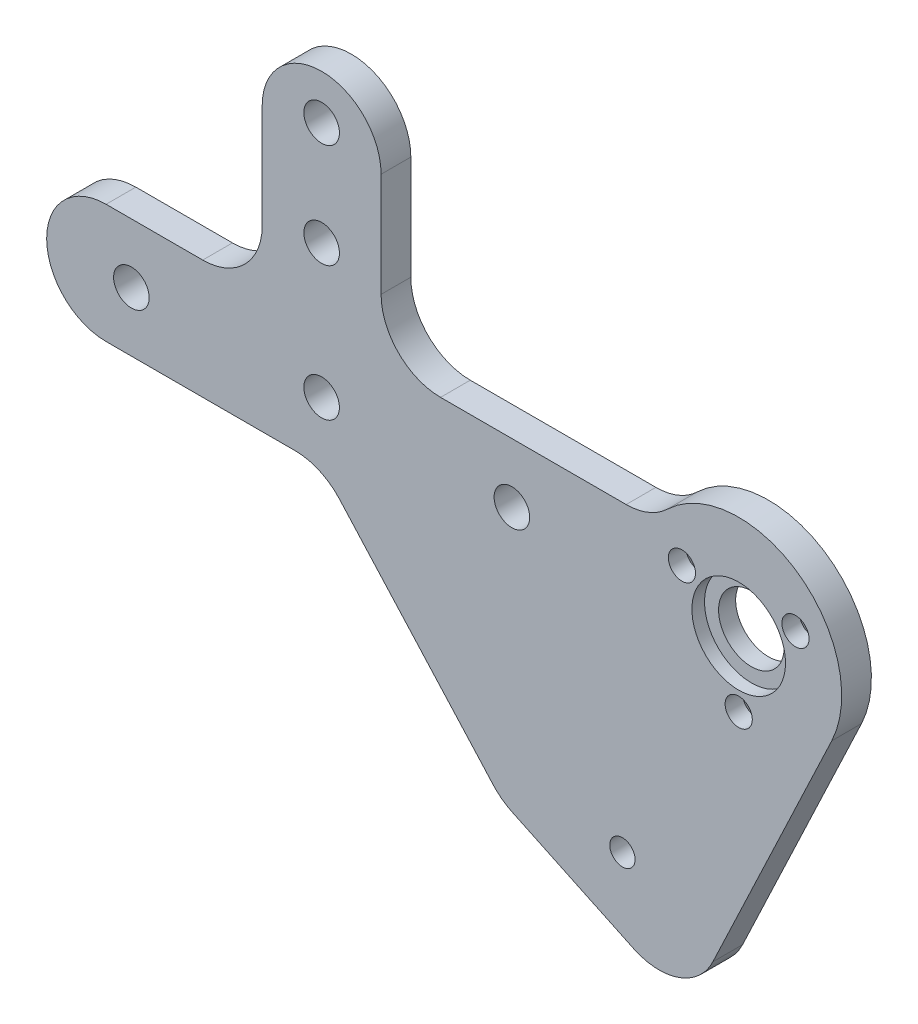
from build123d import *

# Parameters (mm, degrees)
SKETCH1_R                                        = 3.5
BODY_DEPTH                                       = 3.175
F_6_GIMBAL_CLEARANCE_HOLE_D                      = 3.7973
F_6_GIMBAL_CLEARANCE_HOLE_DEPTH                  = 12
F_6_GIMBAL_CLEARANCE_HOLE_TIP                    = 1.140824014
CSK_FOR_M2_5_FLAT_HEAD_MACHINE_SCREW_D           = 2.9
CSK_FOR_M2_5_FLAT_HEAD_MACHINE_SCREW_CSINK_D     = 5.5
CSK_FOR_M2_5_FLAT_HEAD_MACHINE_SCREW_CSINK_ANGLE = 90
F_6_CIRCULAR_CLEARANCE_HOLES_D                   = 3.7973
F_6_CIRCULAR_CLEARANCE_HOLES_DEPTH               = 12
F_6_CIRCULAR_CLEARANCE_HOLES_TIP                 = 1.140824014
MOTOR_START                                      = 1.82626
SKETCH1_3_R                                      = 5
MOTOR_COLLAR_RELIEF_DEPTH                        = 135.039371942
F_6_32_TAPPED_HOLE_D                             = 2.7051
F_6_32_TAPPED_HOLE_DEPTH                         = 180.4416
F_6_32_TAPPED_HOLE_TIP                           = 0.81269403
FILLET1_R                                        = 6.35


with BuildPart() as part:
    # Sketch1 → Body (new body)
    with BuildSketch(Plane.XY):
        with BuildLine():
            Line((-29.36875, 100.140279829), (-29.36875, 87.440279829))
            Line((-29.36875, 87.440279829), (0, 87.440279829))
            Line((0, 87.440279829), (19.184718186, 66.158495963))
            Line((19.184718186, 66.158495963), (39.064677756, 56.735799561))
            Line((39.064677756, 56.735799561), (54.483635505, 89.266642494))
            ThreePointArc((54.483635505, 89.266642494), (49.996218262, 103.531501135), (35.431784746, 100.140279829))
            Line((35.431784746, 100.140279829), (6.35, 100.140279829))
            Line((6.35, 100.140279829), (6.35, 117.602779829))
            ThreePointArc((6.35, 117.602779829), (0, 123.952779829), (-6.35, 117.602779829))
            Line((-6.35, 117.602779829), (-6.35, 100.140279829))
            Line((-6.35, 100.140279829), (-29.36875, 100.140279829))
        make_face()
        with Locations((44.54365572, 93.977990695)):
            Circle(SKETCH1_R, mode=Mode.SUBTRACT)
    extrude(amount=BODY_DEPTH)

    # #6 Gimbal Clearance Hole
    with Locations(Plane(origin=(0, 108.077779829, 0), x_dir=(-1, 0, 0), z_dir=(0, 0, -1))):
        with Locations((0, 0), (0, 11.1125)):
            Hole(F_6_GIMBAL_CLEARANCE_HOLE_D / 2, depth=F_6_GIMBAL_CLEARANCE_HOLE_DEPTH)
            with Locations((0, 0, -(F_6_GIMBAL_CLEARANCE_HOLE_DEPTH + F_6_GIMBAL_CLEARANCE_HOLE_TIP / 2))):  # 118° drill point
                Cone(0, F_6_GIMBAL_CLEARANCE_HOLE_D / 2, F_6_GIMBAL_CLEARANCE_HOLE_TIP, mode=Mode.SUBTRACT)

    # CSK for M2.5 Flat Head Machine Screw (through all)
    with Locations(Plane(origin=(50.605833546, 97.477990695, 0), x_dir=(-1, 0, 0), z_dir=(0, 0, -1))):
        with Locations((0, 0), (6.062177826, -10.5), (12.124355653, 0)):
            CounterSinkHole(CSK_FOR_M2_5_FLAT_HEAD_MACHINE_SCREW_D / 2, CSK_FOR_M2_5_FLAT_HEAD_MACHINE_SCREW_CSINK_D / 2, counter_sink_angle=CSK_FOR_M2_5_FLAT_HEAD_MACHINE_SCREW_CSINK_ANGLE)

    # #6 Circular Clearance Holes
    with Locations(Plane(origin=(-20.32, 93.790279829, 0), x_dir=(-1, 0, 0), z_dir=(0, 0, -1))):
        with Locations((0, 0), (-20.32, 0), (-40.64, 0)):
            Hole(F_6_CIRCULAR_CLEARANCE_HOLES_D / 2, depth=F_6_CIRCULAR_CLEARANCE_HOLES_DEPTH)
            with Locations((0, 0, -(F_6_CIRCULAR_CLEARANCE_HOLES_DEPTH + F_6_CIRCULAR_CLEARANCE_HOLES_TIP / 2))):  # 118° drill point
                Cone(0, F_6_CIRCULAR_CLEARANCE_HOLES_D / 2, F_6_CIRCULAR_CLEARANCE_HOLES_TIP, mode=Mode.SUBTRACT)

    # Sketch1<3> → Motor Collar Relief (cut, through all)
    with BuildSketch(Plane.XY.offset(MOTOR_START)):
        with Locations((44.54365572, 93.977990695)):
            Circle(SKETCH1_3_R)
    extrude(amount=MOTOR_COLLAR_RELIEF_DEPTH, mode=Mode.SUBTRACT)

    # #6-32 Tapped Hole
    with Locations(Plane(origin=(32.122828644, 67.772589444, 0), x_dir=(-1, 0, 0), z_dir=(0, 0, -1))):
        with Locations((0, 0)):
            Hole(F_6_32_TAPPED_HOLE_D / 2, depth=F_6_32_TAPPED_HOLE_DEPTH)
            with Locations((0, 0, -(F_6_32_TAPPED_HOLE_DEPTH + F_6_32_TAPPED_HOLE_TIP / 2))):  # 118° drill point
                Cone(0, F_6_32_TAPPED_HOLE_D / 2, F_6_32_TAPPED_HOLE_TIP, mode=Mode.SUBTRACT)

    # Fillet1
    fillet1_edges = [part.edges().sort_by_distance(p)[0] for p in [
        (0, 87.440279829, 1.5875),
        (-29.36875, 87.440279829, 1.5875),
        (-29.36875, 100.140279829, 1.5875),
        (-6.35, 100.140279829, 1.5875),
        (6.35, 100.140279829, 1.5875),
        (35.431784746, 100.140279829, 1.5875),
        (39.064677756, 56.735799561, 1.5875),
        (19.184718186, 66.158495963, 1.5875),
    ]]
    fillet(fillet1_edges, radius=FILLET1_R - 0.0001)  # a hair under: the kernel refuses the full size


solid = part.part
